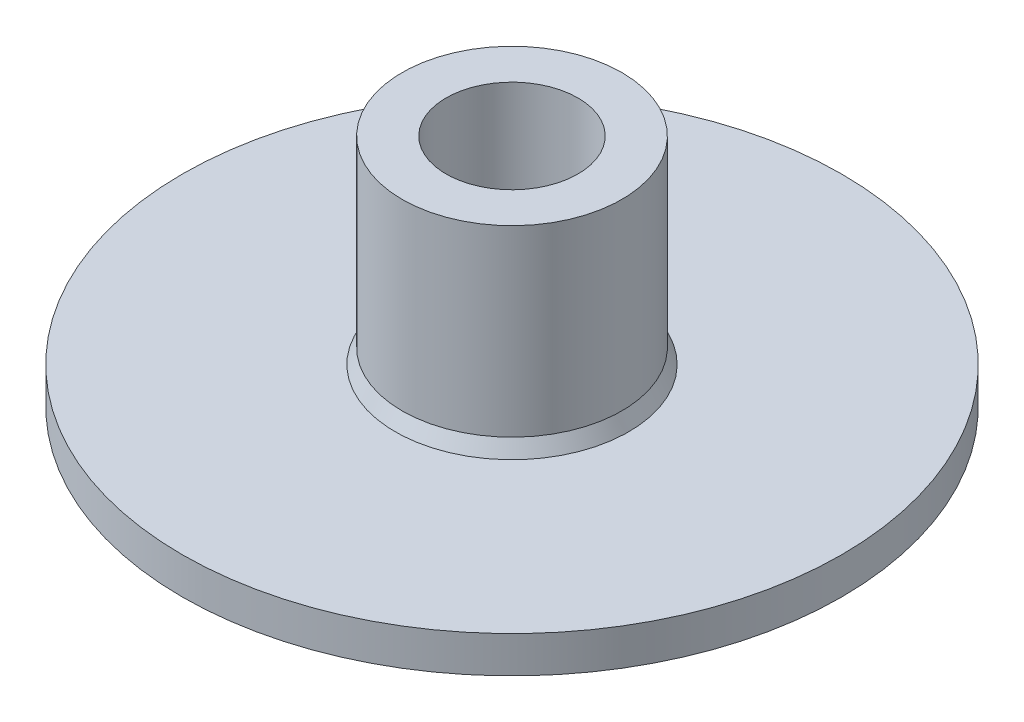
from build123d import *

# Parameters (mm, degrees)
RACCORDO2_R = 0.2


with BuildPart() as part:
    # Schizzo1 → Rivoluzione1 (revolve)
    with BuildSketch(Plane.XY):
        Polygon((-45, 5), (-45, 0), (-34.4, 0), (-34.4, 1.3), (-32, 1.3), (-32, 0), (-29.5, 0), (-29.5, 1.3), (-27.1, 1.3), (-27.1, 0), (-24, 0), (-18.4, 0), (-18.4, 1.3), (-16, 1.3), (-16, 0), (-13, 0), (-9, 8.5), (-9, 32), (-15, 32), (-15, 7), (-15.941176471, 5), align=None)
    revolve(axis=Axis((0, 0, 0), (0, 1, 0)))

    # Raccordo2
    raccordo2_edges = [part.edges().sort_by_distance(p)[0] for p in [
        (18.4, 1.3, 0),
        (16, 1.3, 0),
        (29.5, 1.3, 0),
        (27.1, 1.3, 0),
        (34.4, 1.3, 0),
        (32, 1.3, 0),
    ]]
    fillet(raccordo2_edges, radius=RACCORDO2_R)


solid = part.part
